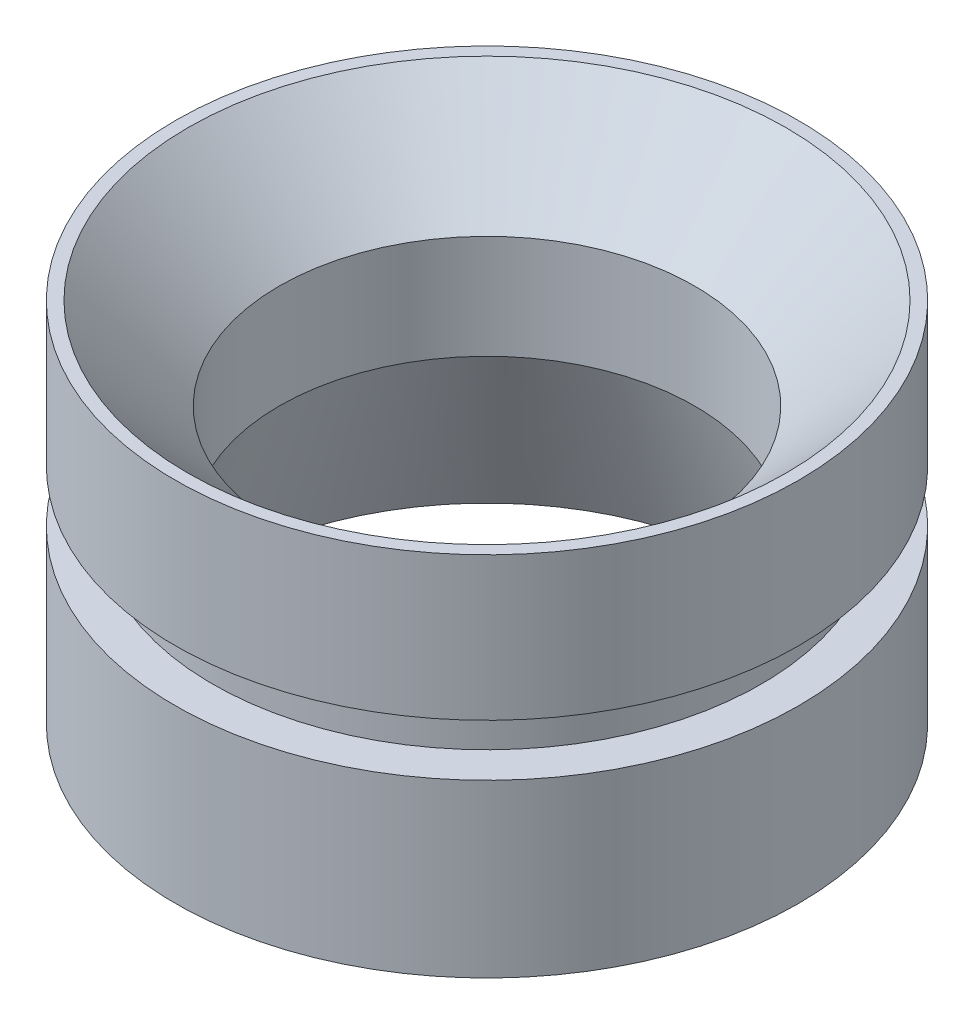
from build123d import *


with BuildPart() as part:
    # Sketch1 → Revolve1 (revolve)
    with BuildSketch(Plane.XY):
        Polygon((12.7, -3.175), (12.7, 3.175), (18.288, 8.763), (19.05, 8.763), (19.05, 0), (16.764, 0), (16.764, -3.175), (19.05, -3.175), (19.05, -13.642888968), (16.51, -13.642888968), align=None)
    revolve(axis=Axis((0, 44.779079664, 0), (0, -1, 0)))


solid = part.part
